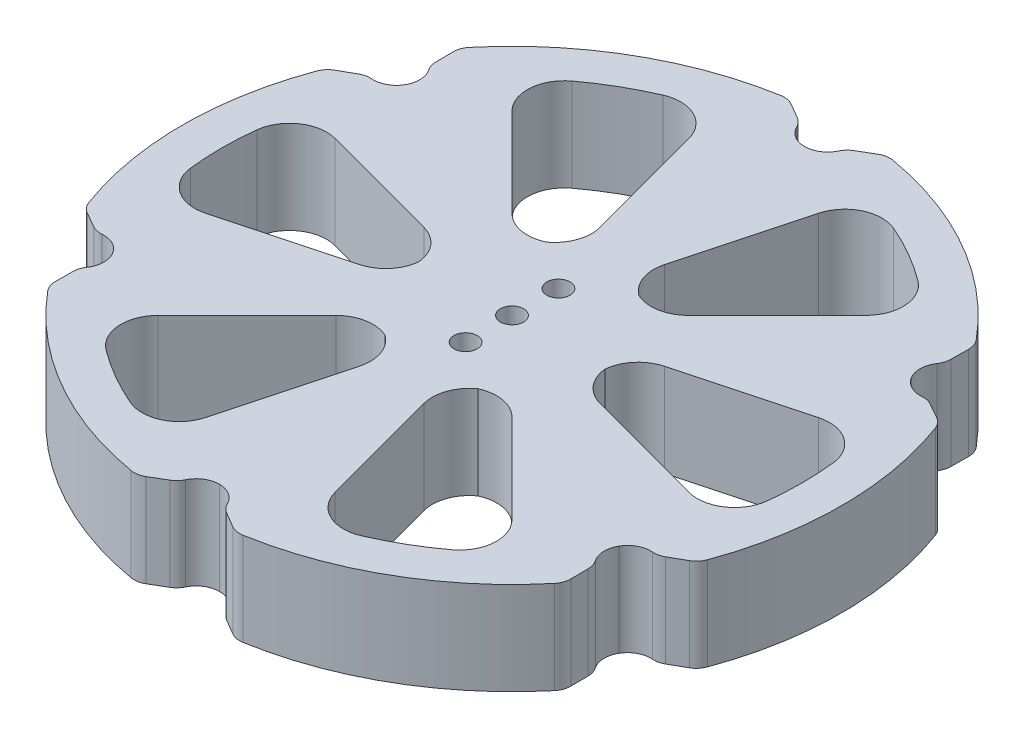
from build123d import *

# Parameters (mm, degrees)
SKETCH1_R                = 45.085
BOSS_EXTRUDE1_DEPTH      = 12.7
SKETCH2_W                = 6.35
SKETCH2_H                = 6.35
CUT_EXTRUDE1_DEPTH       = 25.4
FILLET1_R                = 3.175
SKETCH3_R                = 1.5875
CUT_EXTRUDE2_DEPTH       = 25.4
CUT_EXTRUDE4_DEPTH       = 25.4
FILLET4_R                = 5.08
CIRPATTERN3_COUNT        = 6
FILLET4_OF_CIRPATTERN3_R = 5.08
SKETCH5_R                = 1.5875
CUT_EXTRUDE5_DEPTH       = 15.24
CHAMFER1_START           = -1
CHAMFER1_DEPTH           = 15
FILLET5_R                = 2.54
CIRPATTERN7_START        = -1
CIRPATTERN7_DEPTH        = 15


with BuildPart() as part:
    # Sketch1 → Boss-Extrude1 (new body)
    with BuildSketch(Plane(origin=(0, 0, 0), x_dir=(1, 0, 0), z_dir=(0, 1, 0))):
        with Locations(Location((0, 0, 0), (0, 0, 270))):
            Circle(SKETCH1_R)
    extrude(amount=BOSS_EXTRUDE1_DEPTH)

    # Sketch2 → Cut-Extrude1 (cut)
    with BuildSketch(Plane(origin=(0, 12.7, 0), x_dir=(1, 0, 0), z_dir=(0, 1, 0))):
        with Locations((0, 43.18)):
            Rectangle(SKETCH2_W, SKETCH2_H)
    extrude(amount=-CUT_EXTRUDE1_DEPTH, mode=Mode.SUBTRACT)

    # Fillet1
    fillet1_edges = [part.edges().sort_by_distance(p)[0] for p in [
        (3.175, 6.35, -40.005),
        (-3.175, 6.35, -40.005),
    ]]
    fillet(fillet1_edges, radius=FILLET1_R - 0.0001)  # a hair under: the kernel refuses the full size

    # Sketch3 → Cut-Extrude2 (cut)
    with BuildSketch(Plane(origin=(0, 12.7, 0), x_dir=(1, 0, 0), z_dir=(0, 1, 0))):
        with Locations(Location((0, 0, 0), (0, 0, 270))):
            Circle(SKETCH3_R)
    extrude(amount=-CUT_EXTRUDE2_DEPTH, mode=Mode.SUBTRACT)

    # Sketch4 → Cut-Extrude4 (cut)
    with BuildSketch(Plane(origin=(0, 12.7, 0), x_dir=(1, 0, 0), z_dir=(0, 1, 0))):
        with BuildLine():
            Line((10.271880853, 38.335181231), (3.287001873, 12.267257994))
            ThreePointArc((3.287001873, 12.267257994), (6.35, 10.998522628), (8.980256121, 8.980256121))
            Line((8.980256121, 8.980256121), (28.063300378, 28.063300378))
            ThreePointArc((28.063300378, 28.063300378), (19.84375, 34.370383213), (10.271880853, 38.335181231))
        make_face()
    cut_extrude4 = extrude(amount=-CUT_EXTRUDE4_DEPTH, mode=Mode.SUBTRACT)

    # Fillet4
    # the kernel refuses this fillet: 5.08 mm, written as the material it adds along each edge
    with BuildSketch(Plane(origin=(8.980256121, 12.7, -8.980256121), x_dir=(0.707106781186551, 0, -0.7071067811865441), z_dir=(0, -1, 0))) as fillet4_piece_1:
        with BuildLine():
            CenterArc((4.338837989, -5.08), FILLET4_R, 90, 73.398450401)
            ThreePointArc((-0.529401437, -3.628571429), (-0.133047272, -1.833493693), (0, 0))
            Line((0, 0), (4.338837989, 0))
        make_face()
    extrude(amount=12.7)
    with BuildSketch(Plane(origin=(3.287001873, 12.7, -12.267257994), x_dir=(0.2588190451024908, 0, -0.9659258262890763), z_dir=(0, -1, 0))) as fillet4_piece_2:
        with BuildLine():
            CenterArc((4.338837989, 5.08), FILLET4_R, 196.601549599, 73.398450401)
            ThreePointArc((-0.529401437, 3.628571429), (-0.133047272, 1.833493693), (0, 0))
            Line((0, 0), (4.338837989, 0))
        make_face()
    extrude(amount=12.7)
    with BuildSketch(Plane(origin=(28.063300378, 12.7, -28.063300378), x_dir=(-0.7071067811865437, 0, 0.7071067811865515), z_dir=(0, -1, 0))) as fillet4_piece_3:
        with BuildLine():
            CenterArc((5.454874389, 5.08), FILLET4_R, 171.559110559, 98.440889441)
            ThreePointArc((0.429901822, 5.825688073), (0.107621375, 2.920764331), (0, 0))
            Line((0, 0), (5.454874389, 0))
        make_face()
    extrude(amount=12.7)
    with BuildSketch(Plane(origin=(10.271880853, 12.7, -38.335181231), x_dir=(0.9442589613921284, 0, 0.3292036054338696), z_dir=(0, -1, 0))) as fillet4_piece_4:
        with BuildLine():
            CenterArc((5.467670827, 5.066224464), FILLET4_R, 175.779555279, 98.440889441)
            Line((0.401446363, 5.440082298), (0, 0))
            ThreePointArc((0, 0), (2.920764331, -0.107621375), (5.841528662, 0))
        make_face()
    extrude(amount=12.7)

    # CirPattern3: Cut-Extrude4 ×6 about axis
    cirpattern3_axis = Axis((0, 0, 0), (0, 1, 0))
    for i in range(1, CIRPATTERN3_COUNT):
        add(cut_extrude4.rotate(cirpattern3_axis, i * 360 / CIRPATTERN3_COUNT), mode=Mode.SUBTRACT)

    # Fillet4 of CirPattern3
    # the kernel refuses this fillet: 5.08 mm, written as the material it adds along each edge
    with BuildSketch(Plane(origin=(-3.287001873, 12.7, -12.267257994), x_dir=(-0.25881904510251585, 0, -0.9659258262890695), z_dir=(0, -1, 0)), Plane(origin=(-12.267257994, 12.7, -3.287001873), x_dir=(-0.965925826289067, 0, -0.2588190451025258), z_dir=(0, -1, 0)), Plane(origin=(-8.980256121, 12.7, 8.980256121), x_dir=(-0.7071067811865508, 0, 0.7071067811865442), z_dir=(0, -1, 0)), Plane(origin=(3.287001873, 12.7, 12.267257994), x_dir=(0.2588190451025157, 0, 0.9659258262890696), z_dir=(0, -1, 0)), Plane(origin=(12.267257994, 12.7, 3.287001873), x_dir=(0.9659258262890671, 0, 0.25881904510252524), z_dir=(0, -1, 0))) as fillet4_of_cirpattern3_piece_1:
        with BuildLine():
            CenterArc((4.338837989, -5.08), FILLET4_OF_CIRPATTERN3_R, 90, 73.398450401)
            ThreePointArc((-0.529401437, -3.628571429), (-0.133047272, -1.833493693), (0, 0))
            Line((0, 0), (4.338837989, 0))
        make_face()
    extrude(amount=12.7)
    with BuildSketch(Plane(origin=(-8.980256121, 12.7, -8.980256121), x_dir=(0.801783725737267, 0, -0.5976143046672051), z_dir=(0, -1, 0)), Plane(origin=(-12.267257994, 12.7, 3.287001873), x_dir=(-0.1166573066381411, 0, -0.9931722271630106), z_dir=(0, -1, 0)), Plane(origin=(-3.287001873, 12.7, 12.267257994), x_dir=(-0.9184410323754069, 0, -0.39555792249580446), z_dir=(0, -1, 0)), Plane(origin=(8.980256121, 12.7, 8.980256121), x_dir=(-0.8017837257372662, 0, 0.5976143046672062), z_dir=(0, -1, 0))) as fillet4_of_cirpattern3_piece_2:
        with BuildLine():
            CenterArc((4.400384864, -5.026781091), FILLET4_OF_CIRPATTERN3_R, 98.3007748, 73.398450401)
            Line((-0.626396227, -4.293383614), (0, 0))
            ThreePointArc((0, 0), (1.833493693, -0.133047272), (3.666987387, 0))
        make_face()
    extrude(amount=12.7)
    with BuildSketch(Plane(origin=(-10.271880853, 12.7, -38.335181231), x_dir=(0.25881904510252557, 0, 0.9659258262890671), z_dir=(0, -1, 0)), Plane(origin=(-38.335181231, 12.7, -10.271880853), x_dir=(0.9659258262890696, 0, 0.25881904510251547), z_dir=(0, -1, 0)), Plane(origin=(-28.063300378, 12.7, 28.063300378), x_dir=(0.7071067811865429, 0, -0.707106781186552), z_dir=(0, -1, 0)), Plane(origin=(10.271880853, 12.7, 38.335181231), x_dir=(-0.2588190451025262, 0, -0.9659258262890669), z_dir=(0, -1, 0)), Plane(origin=(38.335181231, 12.7, 10.271880853), x_dir=(-0.9659258262890699, 0, -0.25881904510251486), z_dir=(0, -1, 0))) as fillet4_of_cirpattern3_piece_3:
        with BuildLine():
            CenterArc((5.454874389, 5.08), FILLET4_OF_CIRPATTERN3_R, 171.559110559, 98.440889441)
            ThreePointArc((0.429901822, 5.825688073), (0.107621375, 2.920764331), (0, 0))
            Line((0, 0), (5.454874389, 0))
        make_face()
    extrude(amount=12.7)
    with BuildSketch(Plane(origin=(-28.063300378, 12.7, -28.063300378), x_dir=(0.757228166019224, 0, -0.653150445599758), z_dir=(0, -1, 0)), Plane(origin=(-38.335181231, 12.7, 10.271880853), x_dir=(-0.18703079537290557, 0, -0.9823540510336272), z_dir=(0, -1, 0)), Plane(origin=(-10.271880853, 12.7, 38.335181231), x_dir=(-0.9442589613921285, 0, -0.32920360543386923), z_dir=(0, -1, 0)), Plane(origin=(28.063300378, 12.7, 28.063300378), x_dir=(-0.7572281660192255, 0, 0.6531504455997565), z_dir=(0, -1, 0)), Plane(origin=(38.335181231, 12.7, -10.271880853), x_dir=(0.1870307953729042, 0, 0.9823540510336275), z_dir=(0, -1, 0))) as fillet4_of_cirpattern3_piece_4:
        with BuildLine():
            CenterArc((5.467670827, 5.066224464), FILLET4_OF_CIRPATTERN3_R, 175.779555279, 98.440889441)
            Line((0.401446363, 5.440082298), (0, 0))
            ThreePointArc((0, 0), (2.920764331, -0.107621375), (5.841528662, 0))
        make_face()
    extrude(amount=12.7)
    with BuildSketch(Plane(origin=(12.267257994, 12.7, -3.287001873), x_dir=(0.9659258262890604, 0, -0.25881904510255027), z_dir=(0, -1, 0))) as fillet4_of_cirpattern3_piece_5:
        with BuildLine():
            CenterArc((4.338837989, 5.08), FILLET4_OF_CIRPATTERN3_R, 196.601549599, 73.398450401)
            ThreePointArc((-0.529401437, 3.628571429), (-0.133047272, 1.833493693), (0, 0))
            Line((0, 0), (4.338837989, 0))
        make_face()
    extrude(amount=12.7)

    # Sketch5 → Cut-Extrude5 (cut)
    with BuildSketch(Plane.XZ):
        with Locations(Location((0, 6.35, 0), (0, 0, 270))):
            Circle(SKETCH5_R)
        with Locations(Location((0, -6.35, 0), (0, 0, 270))):
            Circle(SKETCH5_R)
    extrude(amount=-CUT_EXTRUDE5_DEPTH, mode=Mode.SUBTRACT)

    # Chamfer1: read off the stored shape, not the designer's step
    # Chamfer1 outline → Chamfer1 (cut)
    with BuildSketch(Plane(origin=(0, 0, 0), x_dir=(1, 0, 0), z_dir=(0, 1, 0)).offset(CHAMFER1_START)):
        with BuildLine():
            Line((-6.718968573, 44.581528532), (-3.087994239, 42.441815348))
            ThreePointArc((-3.087994239, 42.441815348), (-3.153173537, 42.808352794), (-3.175, 43.18))
            Line((-3.175, 43.18), (-3.175, 44.973065272))
            ThreePointArc((-3.175, 44.973065272), (-4.950856369, 44.812344797), (-6.718968573, 44.581528532))
        make_face()
        with BuildLine():
            Line((3.087994239, 42.441815348), (6.718968573, 44.581528532))
            ThreePointArc((6.718968573, 44.581528532), (4.950856369, 44.812344797), (3.175, 44.973065272))
            Line((3.175, 44.973065272), (3.175, 43.18))
            ThreePointArc((3.175, 43.18), (3.153173537, 42.808352794), (3.087994239, 42.441815348))
        make_face()
    extrude(amount=CHAMFER1_DEPTH, mode=Mode.SUBTRACT)

    # Fillet5
    fillet5_edges = [part.edges().sort_by_distance(p)[0] for p in [
        (6.718968573, 6.35, -44.581528532),
        (-6.718968573, 6.35, -44.581528532),
        (-3.088018782, 6.35, -42.441829811),
        (3.088018782, 6.35, -42.441829811),
    ]]
    fillet(fillet5_edges, radius=FILLET5_R)

    # CirPattern7: read off the stored shape, not the designer's step
    # CirPattern7 outline → CirPattern7 (cut)
    with BuildSketch(Plane(origin=(0, 0, 0), x_dir=(1, 0, 0), z_dir=(0, 1, 0)).offset(CIRPATTERN7_START)):
        with BuildLine():
            ThreePointArc((41.170667008, 16.92300591), (41.855471454, 16.357303704), (42.303623317, 15.590403436))
            ThreePointArc((42.303623317, 15.590403436), (39.04475533, 22.5425), (34.653497089, 28.840810746))
            ThreePointArc((34.653497089, 28.840810746), (35.093576272, 28.069249714), (35.24108653, 27.193340565))
            Line((35.24108653, 27.193340565), (35.219727473, 24.796698321))
            ThreePointArc((35.219727473, 24.796698321), (35.102820214, 24.057290552), (34.775449936, 23.384074497))
            ThreePointArc((34.775449936, 23.384074497), (34.222324259, 21.71206554), (34.645346278, 20.0025))
            ThreePointArc((34.645346278, 20.0025), (35.914362456, 18.781369415), (37.638927526, 18.424385824))
            ThreePointArc((37.638927526, 18.424385824), (38.385634871, 18.371288774), (39.084434412, 18.102829545))
            Line((39.084434412, 18.102829545), (41.170667008, 16.92300591))
        make_face()
        with BuildLine():
            ThreePointArc((35.24108653, -27.193340565), (35.093576272, -28.069249714), (34.653497089, -28.840810746))
            ThreePointArc((34.653497089, -28.840810746), (39.04475533, -22.5425), (42.303623317, -15.590403436))
            ThreePointArc((42.303623317, -15.590403436), (41.855471454, -16.357303704), (41.170667008, -16.92300591))
            Line((41.170667008, -16.92300591), (39.084434412, -18.102829545))
            ThreePointArc((39.084434412, -18.102829545), (38.385634871, -18.371288774), (37.638927526, -18.424385824))
            ThreePointArc((37.638927526, -18.424385824), (35.914362456, -18.781369415), (34.645346278, -20.0025))
            ThreePointArc((34.645346278, -20.0025), (34.222324259, -21.71206554), (34.775449936, -23.384074497))
            ThreePointArc((34.775449936, -23.384074497), (35.102820214, -24.057290552), (35.219727473, -24.796698321))
            Line((35.219727473, -24.796698321), (35.24108653, -27.193340565))
        make_face()
        with BuildLine():
            ThreePointArc((-5.929580478, -44.116346474), (-6.761895182, -44.426553418), (-7.650126228, -44.431214182))
            ThreePointArc((-7.650126228, -44.431214182), (0, -45.085), (7.650126228, -44.431214182))
            ThreePointArc((7.650126228, -44.431214182), (6.761895182, -44.426553418), (5.929580478, -44.116346474))
            Line((5.929580478, -44.116346474), (3.864706939, -42.899527866))
            ThreePointArc((3.864706939, -42.899527866), (3.282814657, -42.428579326), (2.86347759, -41.808460321))
            ThreePointArc((2.86347759, -41.808460321), (1.692038197, -40.493434955), (0, -40.005))
            ThreePointArc((0, -40.005), (-1.692038197, -40.493434955), (-2.86347759, -41.808460321))
            ThreePointArc((-2.86347759, -41.808460321), (-3.282814657, -42.428579326), (-3.864706939, -42.899527866))
            Line((-3.864706939, -42.899527866), (-5.929580478, -44.116346474))
        make_face()
        with BuildLine():
            ThreePointArc((-41.170667008, -16.92300591), (-41.855471454, -16.357303704), (-42.303623317, -15.590403436))
            ThreePointArc((-42.303623317, -15.590403436), (-39.04475533, -22.5425), (-34.653497089, -28.840810746))
            ThreePointArc((-34.653497089, -28.840810746), (-35.093576272, -28.069249714), (-35.24108653, -27.193340565))
            Line((-35.24108653, -27.193340565), (-35.219727473, -24.796698321))
            ThreePointArc((-35.219727473, -24.796698321), (-35.102820214, -24.057290552), (-34.775449936, -23.384074497))
            ThreePointArc((-34.775449936, -23.384074497), (-34.222324259, -21.71206554), (-34.645346278, -20.0025))
            ThreePointArc((-34.645346278, -20.0025), (-35.914362456, -18.781369415), (-37.638927526, -18.424385824))
            ThreePointArc((-37.638927526, -18.424385824), (-38.385634871, -18.371288774), (-39.084434412, -18.102829545))
            Line((-39.084434412, -18.102829545), (-41.170667008, -16.92300591))
        make_face()
        with BuildLine():
            ThreePointArc((-37.638927526, 18.424385824), (-35.914362456, 18.781369415), (-34.645346278, 20.0025))
            ThreePointArc((-34.645346278, 20.0025), (-34.222324259, 21.71206554), (-34.775449936, 23.384074497))
            ThreePointArc((-34.775449936, 23.384074497), (-35.102820214, 24.057290552), (-35.219727473, 24.796698321))
            Line((-35.219727473, 24.796698321), (-35.24108653, 27.193340565))
            ThreePointArc((-35.24108653, 27.193340565), (-35.093576272, 28.069249714), (-34.653497089, 28.840810746))
            ThreePointArc((-34.653497089, 28.840810746), (-39.04475533, 22.5425), (-42.303623316, 15.590403436))
            ThreePointArc((-42.303623316, 15.590403436), (-41.855471454, 16.357303704), (-41.170667008, 16.92300591))
            Line((-41.170667008, 16.92300591), (-39.084434412, 18.102829545))
            ThreePointArc((-39.084434412, 18.102829545), (-38.385634871, 18.371288774), (-37.638927526, 18.424385824))
        make_face()
    extrude(amount=CIRPATTERN7_DEPTH, mode=Mode.SUBTRACT)


solid = part.part
